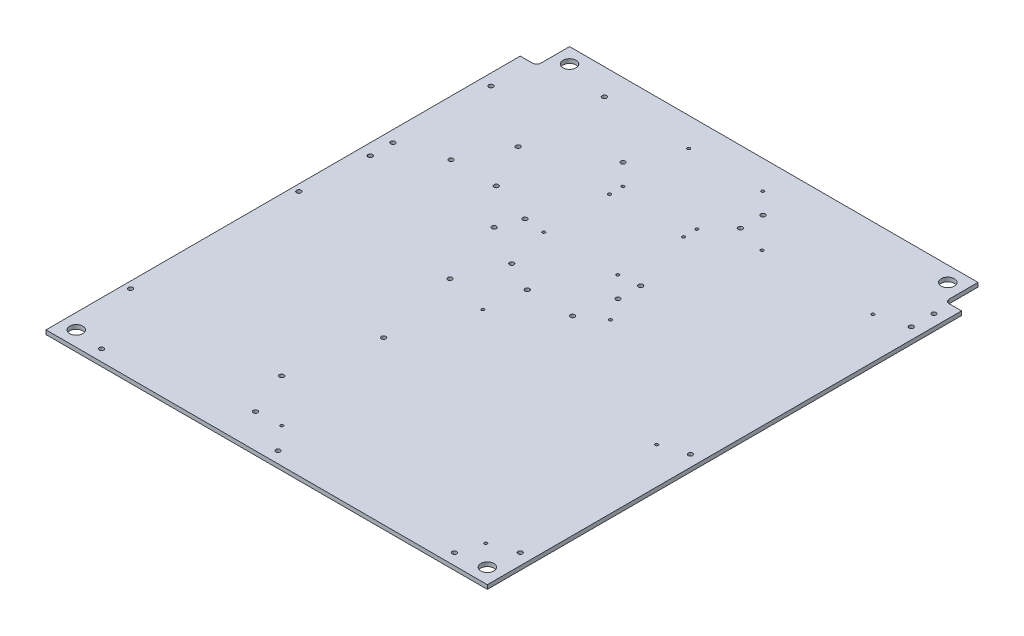
from build123d import *

# Parameters (mm, degrees)
SKETCH1_W               = 340.868
SKETCH1_H               = 391.668
BOSS_EXTRUDE1_DEPTH     = 3.175
CUT_EXTRUDE1_DEPTH      = 10
F_3_8_CLEARANCE_HOLE1_D = 10.0838
F_4_40_TAPPED_HOLE1_D   = 2.2606
F_8_32_TAPPED_HOLE1_D   = 3.4544
F_4_40_TAPPED_HOLE2_D   = 2.2606
F_8_32_TAPPED_HOLE2_D   = 3.4544


with BuildPart() as part:
    # Sketch1 → Boss-Extrude1 (new body)
    with BuildSketch(Plane(origin=(0, 0, 0), x_dir=(1, 0, 0), z_dir=(0, 1, 0))):
        Rectangle(SKETCH1_W, SKETCH1_H)
    extrude(amount=BOSS_EXTRUDE1_DEPTH)

    # Sketch2 → Cut-Extrude1 (cut)
    with BuildSketch(Plane(origin=(0, 3.175, 0), x_dir=(1, 0, 0), z_dir=(0, 1, 0))):
        with BuildLine():
            Line((-170.434, 195.834), (-157.734, 195.834))
            Line((-157.734, 195.834), (-157.734, 173.609))
            ThreePointArc((-157.734, 173.609), (-158.66393597, 171.36393597), (-160.909, 170.434))
            Line((-160.909, 170.434), (-170.434, 170.434))
            Line((-170.434, 170.434), (-170.434, 195.834))
        make_face()
        with BuildLine():
            Line((170.434, 195.834), (157.734, 195.834))
            Line((157.734, 195.834), (157.734, 173.609))
            ThreePointArc((157.734, 173.609), (158.66393597, 171.36393597), (160.909, 170.434))
            Line((160.909, 170.434), (170.434, 170.434))
            Line((170.434, 170.434), (170.434, 195.834))
        make_face()
    extrude(amount=-CUT_EXTRUDE1_DEPTH, mode=Mode.SUBTRACT)

    # 3/8 Clearance Hole1 (through all)
    with Locations(Plane(origin=(0, 3.175, 0), x_dir=(1, 0, 0), z_dir=(0, 1, 0))):
        with Locations((158.75, -184.15), (-158.75, -184.15), (-146.05, 184.15), (146.05, 184.15)):
            Hole(F_3_8_CLEARANCE_HOLE1_D / 2)

    # #4-40 Tapped Hole1 (through all)
    with Locations(Plane(origin=(0, 3.175, 0), x_dir=(1, 0, 0), z_dir=(0, 1, 0))):
        with Locations((-15.34, -13.51), (142.14, -36.73), (142.14, -168.81), (-15.34, -168.81), (-43.575, 61.759), (13.575, 61.759), (13.575, 112.559), (-43.575, 112.559), (-43.575, 122.909), (-43.575, 173.709), (13.575, 173.709), (13.575, 122.909)):
            Hole(F_4_40_TAPPED_HOLE1_D / 2)

    # #8-32 Tapped Hole1 (through all)
    with Locations(Plane(origin=(0, 3.175, 0), x_dir=(1, 0, 0), z_dir=(0, 1, 0))):
        with Locations((-165.334, -5.625), (-165.334, -135.625), (-48.634, -135.625), (-48.634, -5.625)):
            Hole(F_8_32_TAPPED_HOLE1_D / 2)

    # #4-40 Tapped Hole2 (through all)
    with Locations(Plane(origin=(0, 3.175, 0), x_dir=(1, 0, 0), z_dir=(0, 1, 0))):
        with Locations((138.509, 133.909), (52.859, 133.909), (40.864, 28.904)):
            Hole(F_4_40_TAPPED_HOLE2_D / 2)

    # #8-32 Tapped Hole2 (through all)
    with Locations(Plane(origin=(0, 3.175, 0), x_dir=(1, 0, 0), z_dir=(0, 1, 0))):
        with Locations((-127.822204925, 74.30826235), (-92.822204925, 74.30826235), (-59.684, 139.084), (-59.684, 63.334), (-161.684, 45.834), (-161.684, 63.334), (-161.684, 139.084), (29.684, 45.834), (29.684, 63.334), (29.684, 140.334), (29.684, 157.834), (161.684, 157.834), (161.684, 140.334), (161.684, -161.684), (161.684, -30.234842243), (136.284, -187.084), (0, -187.084), (-136.284, -187.084), (-34.884, -169.584), (-34.884, 28.334), (-34.884, -70.625), (-66, 45.834), (-110.684, 175.684), (-110.684, 109.084), (-11.384, 16.834), (23.616, 16.834)):
            Hole(F_8_32_TAPPED_HOLE2_D / 2)


solid = part.part
